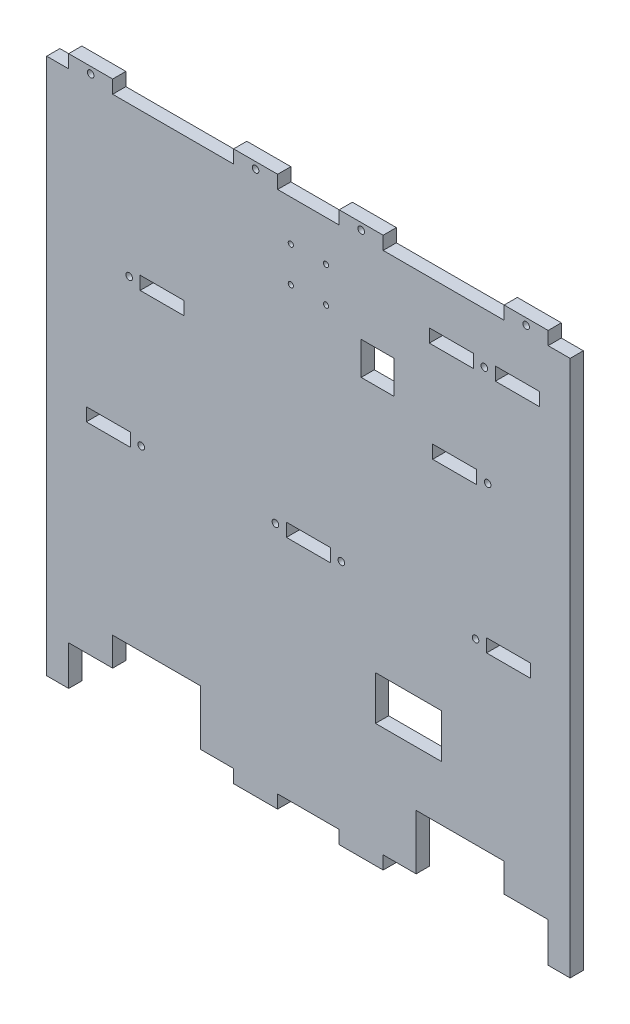
from build123d import *

# Parameters (mm, degrees)
ESQUISSE1_W             = 218
ESQUISSE1_H             = 238
ESQUISSE1_W_2           = 20
ESQUISSE1_H_2           = 6
ESQUISSE1_W_3           = 30
ESQUISSE1_H_3           = 20
ESQUISSE1_W_4           = 15
ESQUISSE1_H_4           = 15
BOSS_EXTRU_1_DEPTH      = 6
ESQUISSE2_W             = 40
ESQUISSE2_H             = 25
ENL_V_MAT_EXTRU_1_DEPTH = 6
ESQUISSE3_W             = 20
ESQUISSE3_H             = 6
BOSS_EXTRU_3_DEPTH      = 6
ESQUISSE4_R             = 1.5
ENL_V_MAT_EXTRU_2_DEPTH = 6
ESQUISSE5_W             = 10
ESQUISSE5_H             = 244
BOSS_EXTRU_4_DEPTH      = 6
ESQUISSE6_W             = 20
ESQUISSE6_H             = 12
ENL_V_MAT_EXTRU_3_DEPTH = 6
ESQUISSE7_R             = 1.175
ENL_V_MAT_EXTRU_4_DEPTH = 173.690474549


with BuildPart() as part:
    # Esquisse1 → Boss.-Extru.1 (new body)
    with BuildSketch(Plane.XY):
        Rectangle(ESQUISSE1_W, ESQUISSE1_H)
        with Locations((-91, -13)):
            Rectangle(ESQUISSE1_W_2, ESQUISSE1_H_2, mode=Mode.SUBTRACT)
        with Locations((0, -13)):
            Rectangle(ESQUISSE1_W_2, ESQUISSE1_H_2, mode=Mode.SUBTRACT)
        with Locations((91, -13)):
            Rectangle(ESQUISSE1_W_2, ESQUISSE1_H_2, mode=Mode.SUBTRACT)
        with Locations((-66.5, 51)):
            Rectangle(ESQUISSE1_W_2, ESQUISSE1_H_2, mode=Mode.SUBTRACT)
        with Locations((66.5, 51)):
            Rectangle(ESQUISSE1_W_2, ESQUISSE1_H_2, mode=Mode.SUBTRACT)
        with Locations((45.5, -59)):
            Rectangle(ESQUISSE1_W_3, ESQUISSE1_H_3, mode=Mode.SUBTRACT)
        with Locations((65, 96)):
            Rectangle(ESQUISSE1_W_2, ESQUISSE1_H_2, mode=Mode.SUBTRACT)
        with Locations((95, 96)):
            Rectangle(ESQUISSE1_W_2, ESQUISSE1_H_2, mode=Mode.SUBTRACT)
        with Locations((31.5, 71.5)):
            Rectangle(ESQUISSE1_W_4, ESQUISSE1_H_4, mode=Mode.SUBTRACT)
    extrude(amount=BOSS_EXTRU_1_DEPTH)

    # Esquisse2 → Enlèv. mat.-Extru.1 (cut)
    with BuildSketch(Plane.XY.offset(6)):
        with Locations((-69, -106.5)):
            Rectangle(ESQUISSE2_W, ESQUISSE2_H)
        with Locations((69, -106.5)):
            Rectangle(ESQUISSE2_W, ESQUISSE2_H)
    extrude(amount=-ENL_V_MAT_EXTRU_1_DEPTH, mode=Mode.SUBTRACT)

    # Esquisse3 → Boss.-Extru.3 (add)
    with BuildSketch(Plane.XY.offset(6)):
        with Locations((-24, -122)):
            Rectangle(ESQUISSE3_W, ESQUISSE3_H)
        with Locations((24, -122)):
            Rectangle(ESQUISSE3_W, ESQUISSE3_H)
        with Locations((24, 122)):
            Rectangle(ESQUISSE3_W, ESQUISSE3_H)
        with Locations((99, 122)):
            Rectangle(ESQUISSE3_W, ESQUISSE3_H)
        with Locations((-24, 122)):
            Rectangle(ESQUISSE3_W, ESQUISSE3_H)
        with Locations((-99, 122)):
            Rectangle(ESQUISSE3_W, ESQUISSE3_H)
    extrude(amount=-BOSS_EXTRU_3_DEPTH)

    # Esquisse4 → Enlèv. mat.-Extru.2 (cut)
    with BuildSketch(Plane.XY.offset(6)):
        with Locations((-15, -13)):
            Circle(ESQUISSE4_R)
        with Locations((-76, -13)):
            Circle(ESQUISSE4_R)
        with Locations((80, 96)):
            Circle(ESQUISSE4_R)
        with Locations((81.5, 51)):
            Circle(ESQUISSE4_R)
        with Locations((76, -13)):
            Circle(ESQUISSE4_R)
        with Locations((15, -13)):
            Circle(ESQUISSE4_R)
        with Locations((-81.5, 51)):
            Circle(ESQUISSE4_R)
        with Locations((-99, 122)):
            Circle(ESQUISSE4_R)
        with Locations((-24, 122)):
            Circle(ESQUISSE4_R)
        with Locations((24, 122)):
            Circle(ESQUISSE4_R)
        with Locations((99, 122)):
            Circle(ESQUISSE4_R)
    extrude(amount=-ENL_V_MAT_EXTRU_2_DEPTH, mode=Mode.SUBTRACT)

    # Esquisse5 → Boss.-Extru.4 (add)
    with BuildSketch(Plane.XY.offset(6)):
        with Locations((-114, -3)):
            Rectangle(ESQUISSE5_W, ESQUISSE5_H)
        with Locations((114, -3)):
            Rectangle(ESQUISSE5_W, ESQUISSE5_H)
    extrude(amount=-BOSS_EXTRU_4_DEPTH)

    # Esquisse6 → Enlèv. mat.-Extru.3 (cut)
    with BuildSketch(Plane.XY.offset(6)):
        with Locations((99, -113)):
            Rectangle(ESQUISSE6_W, ESQUISSE6_H)
        with Locations((-99, -113)):
            Rectangle(ESQUISSE6_W, ESQUISSE6_H)
    extrude(amount=-ENL_V_MAT_EXTRU_3_DEPTH, mode=Mode.SUBTRACT)

    # Esquisse7 → Enlèv. mat.-Extru.4 (cut, through all)
    with BuildSketch(Plane.XY.offset(6)):
        with Locations((-8, 100.5)):
            Circle(ESQUISSE7_R)
        with Locations((8, 100.5)):
            Circle(ESQUISSE7_R)
        with Locations((-8, 84.5)):
            Circle(ESQUISSE7_R)
        with Locations((8, 84.5)):
            Circle(ESQUISSE7_R)
    extrude(amount=-ENL_V_MAT_EXTRU_4_DEPTH, mode=Mode.SUBTRACT)


solid = part.part
